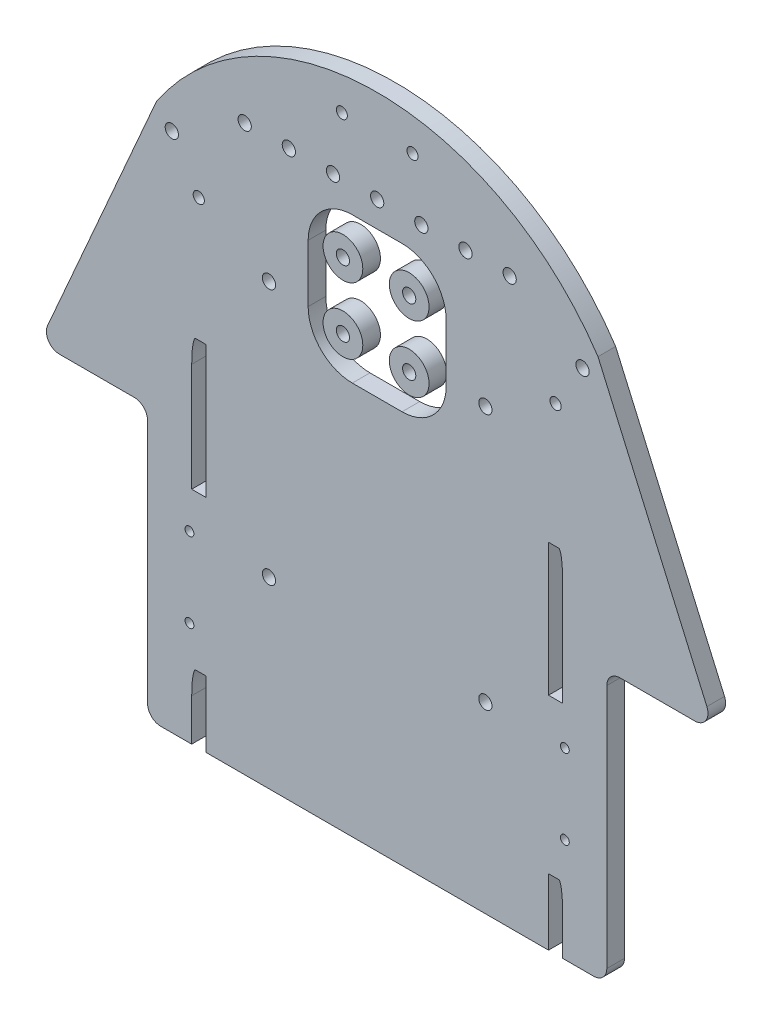
from build123d import *

# Parameters (mm, degrees)
SKETCH2_R             = 1.5
SKETCH2_R_2           = 1.25
SKETCH2_W             = 31.25862069
SKETCH2_H             = 33
BOSS_EXTRUDE1_DEPTH   = 4
SKETCH2_R_3           = 4.5
BOSS_EXTRUDE1_2_DEPTH = 4
BOSS_EXTRUDE1_3_DEPTH = 4
BOSS_EXTRUDE1_4_DEPTH = 4
BOSS_EXTRUDE1_5_DEPTH = 4
FILLET1_R             = 10
BOSS_EXTRUDE2_DEPTH   = 4
FILLET2_R             = 3
SKETCH4_R             = 1
CUT_EXTRUDE1_DEPTH    = 109.461062225
SKETCH5_R             = 1.265
SKETCH5_W             = 3.2
SKETCH5_H             = 30
SKETCH5_H_2           = 15
CUT_EXTRUDE2_DEPTH    = 109.461062225
FILLET2_OF_MIRROR1_R  = 3
FILLET3_SIZE          = 5.5
FILLET3_SIZE_2        = 0.9


with BuildPart() as part:
    # Sketch2 → Boss-Extrude1 (new body)
    with BuildSketch(Plane.XY):
        with BuildLine():
            ThreePointArc((-50, 51.5), (0, 78.333752096), (50, 51.5))
            Line((50, 51.5), (50, -70.5))
            Line((50, -70.5), (-50, -70.5))
            Line((-50, -70.5), (-50, 51.5))
        make_face()
        with Locations((-30, 57.333752096)):
            Circle(SKETCH2_R, mode=Mode.SUBTRACT)
        with Locations((-20, 57.333752096)):
            Circle(SKETCH2_R, mode=Mode.SUBTRACT)
        with Locations((-10, 57.333752096)):
            Circle(SKETCH2_R, mode=Mode.SUBTRACT)
        with Locations((30, 57.333752096)):
            Circle(SKETCH2_R, mode=Mode.SUBTRACT)
        with Locations((20, 57.333752096)):
            Circle(SKETCH2_R, mode=Mode.SUBTRACT)
        with Locations((10, 57.333752096)):
            Circle(SKETCH2_R, mode=Mode.SUBTRACT)
        with Locations((8, 70.333752096)):
            Circle(SKETCH2_R_2, mode=Mode.SUBTRACT)
        with Locations((-8, 70.333752096)):
            Circle(SKETCH2_R_2, mode=Mode.SUBTRACT)
        with Locations((46.5, 47.5)):
            Circle(SKETCH2_R, mode=Mode.SUBTRACT)
        with Locations((-46.5, 47.5)):
            Circle(SKETCH2_R, mode=Mode.SUBTRACT)
        with Locations((24.5, -29)):
            Circle(SKETCH2_R, mode=Mode.SUBTRACT)
        with Locations((-24.5, -29)):
            Circle(SKETCH2_R, mode=Mode.SUBTRACT)
        with Locations((24.5, 29)):
            Circle(SKETCH2_R, mode=Mode.SUBTRACT)
        with Locations((-24.5, 29)):
            Circle(SKETCH2_R, mode=Mode.SUBTRACT)
        with Locations((0, 57.333752096)):
            Circle(SKETCH2_R, mode=Mode.SUBTRACT)
        with Locations((0, 35)):
            Rectangle(SKETCH2_W, SKETCH2_H, mode=Mode.SUBTRACT)
    extrude(amount=BOSS_EXTRUDE1_DEPTH)

    # Fillet1
    fillet1_edges = [part.edges().sort_by_distance(p)[0] for p in [
        (-15.629310345, 51.5, 2),
        (-15.629310345, 18.5, 2),
        (15.629310345, 18.5, 2),
        (15.629310345, 51.5, 2),
    ]]
    fillet(fillet1_edges, radius=FILLET1_R)

    # Sketch3 → Boss-Extrude2 (add)
    with BuildSketch(Plane.XY.offset(4)):
        Polygon((50, 51.5), (76.5, -9), (52, -9), (52, -70.5), (50, -70.5), align=None)
    boss_extrude2 = extrude(amount=-BOSS_EXTRUDE2_DEPTH)

    # Fillet2
    fillet2_edges = [part.edges().sort_by_distance(p)[0] for p in [
        (76.5, -9, 2),
        (52, -9, 2),
        (52, -70.5, 2),
    ]]
    fillet(fillet2_edges, radius=FILLET2_R)

    # Sketch4 → Cut-Extrude1 (cut, through all)
    with BuildSketch(Plane.XY.offset(4)):
        with Locations((42.5, -29)):
            Circle(SKETCH4_R)
        with Locations((42.5, -47)):
            Circle(SKETCH4_R)
    cut_extrude1 = extrude(amount=-CUT_EXTRUDE1_DEPTH, mode=Mode.SUBTRACT)

    # Sketch5 → Cut-Extrude2 (cut, through all)
    with BuildSketch(Plane.XY.offset(4)):
        with Locations((40.4, 37.5)):
            Circle(SKETCH5_R)
        with Locations((40.4, -5.5)):
            Rectangle(SKETCH5_W, SKETCH5_H)
        with Locations((40.4, -63)):
            Rectangle(SKETCH5_W, SKETCH5_H_2)
    cut_extrude2 = extrude(amount=-CUT_EXTRUDE2_DEPTH, mode=Mode.SUBTRACT)

    # Mirror1: Boss-Extrude2, Cut-Extrude1, Cut-Extrude2 across plane
    add(boss_extrude2.mirror(Plane(origin=(0, 0, 0), x_dir=(0, 0, 1), z_dir=(1, 0, 0))))
    add(cut_extrude1.mirror(Plane(origin=(0, 0, 0), x_dir=(0, 0, 1), z_dir=(1, 0, 0))), mode=Mode.SUBTRACT)
    add(cut_extrude2.mirror(Plane(origin=(0, 0, 0), x_dir=(0, 0, 1), z_dir=(1, 0, 0))), mode=Mode.SUBTRACT)

    # Fillet2 of Mirror1
    fillet2_of_mirror1_edges = [part.edges().sort_by_distance(p)[0] for p in [
        (-76.5, -9, 2),
        (-52, -9, 2),
        (-52, -70.5, 2),
    ]]
    fillet(fillet2_of_mirror1_edges, radius=FILLET2_OF_MIRROR1_R)

    # Fillet3
    # an asymmetric fillet: 5.5, 0.9 mm, written as the material it adds along each edge
    with BuildSketch(Plane(origin=(-42, -55.5, 4), x_dir=(0, -1, 0), z_dir=(0, 0, -1)), Plane(origin=(-42, 9.5, 4), x_dir=(0, -1, 0), z_dir=(0, 0, -1))) as fillet3_piece_1:
        with BuildLine():
            Bezier((FILLET3_SIZE, 0), (0, 0), (0, -FILLET3_SIZE_2), weights=[1, 0.707106781, 1])
            Line((0, -FILLET3_SIZE_2), (0, 0))
            Line((0, 0), (FILLET3_SIZE, 0))
        make_face()
    extrude(amount=4)
    with BuildSketch(Plane(origin=(42, -55.5, 4), x_dir=(-1, 0, 0), z_dir=(0, 0, -1)), Plane(origin=(42, 9.5, 4), x_dir=(-1, 0, 0), z_dir=(0, 0, -1))) as fillet3_piece_2:
        with BuildLine():
            Bezier((FILLET3_SIZE_2, 0), (0, 0), (0, -FILLET3_SIZE), weights=[1, 0.707106781, 1])
            Line((0, -FILLET3_SIZE), (0, 0))
            Line((0, 0), (FILLET3_SIZE_2, 0))
        make_face()
    extrude(amount=4)


with BuildPart() as body_2:
    # Sketch2 → Boss-Extrude1 2 (new body)
    with BuildSketch(Plane.XY):
        with Locations((-7.75387504, 42.088883684)):
            Circle(SKETCH2_R_3)
        with Locations((-7.75387504, 42.088883684)):
            Circle(SKETCH2_R, mode=Mode.SUBTRACT)
    extrude(amount=BOSS_EXTRUDE1_2_DEPTH)


with BuildPart() as body_3:
    # Sketch2 → Boss-Extrude1 3 (new body)
    with BuildSketch(Plane.XY):
        with Locations((-7.75387504, 27.088883684)):
            Circle(SKETCH2_R_3)
        with Locations((-7.75387504, 27.088883684)):
            Circle(SKETCH2_R, mode=Mode.SUBTRACT)
    extrude(amount=BOSS_EXTRUDE1_3_DEPTH)


with BuildPart() as body_4:
    # Sketch2 → Boss-Extrude1 4 (new body)
    with BuildSketch(Plane.XY):
        with Locations((7.24612496, 27.088883684)):
            Circle(SKETCH2_R_3)
        with Locations((7.24612496, 27.088883684)):
            Circle(SKETCH2_R, mode=Mode.SUBTRACT)
    extrude(amount=BOSS_EXTRUDE1_4_DEPTH)


with BuildPart() as body_5:
    # Sketch2 → Boss-Extrude1 5 (new body)
    with BuildSketch(Plane.XY):
        with Locations((7.24612496, 42.088883684)):
            Circle(SKETCH2_R_3)
        with Locations((7.24612496, 42.088883684)):
            Circle(SKETCH2_R, mode=Mode.SUBTRACT)
    extrude(amount=BOSS_EXTRUDE1_5_DEPTH)


solid = Compound([part.part, body_2.part, body_3.part, body_4.part, body_5.part])
